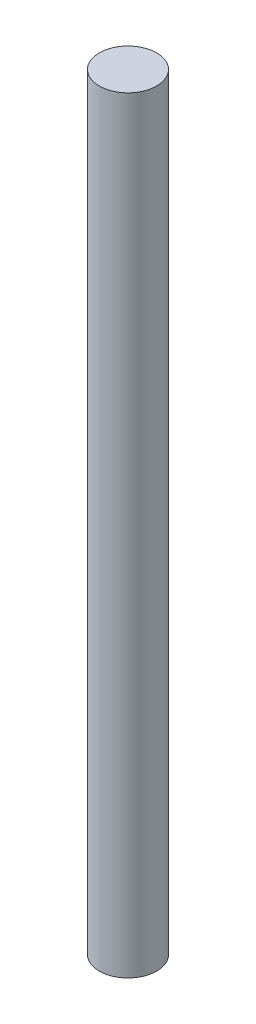
from build123d import *

# Parameters (mm, degrees)
SKETCH1_R           = 1.385
BOSS_EXTRUDE1_DEPTH = 37


with BuildPart() as part:
    # Sketch1 → Boss-Extrude1 (new body)
    with BuildSketch(Plane(origin=(0, 0, 0), x_dir=(1, 0, 0), z_dir=(0, 1, 0))):
        Circle(SKETCH1_R)
    extrude(amount=BOSS_EXTRUDE1_DEPTH)


solid = part.part
